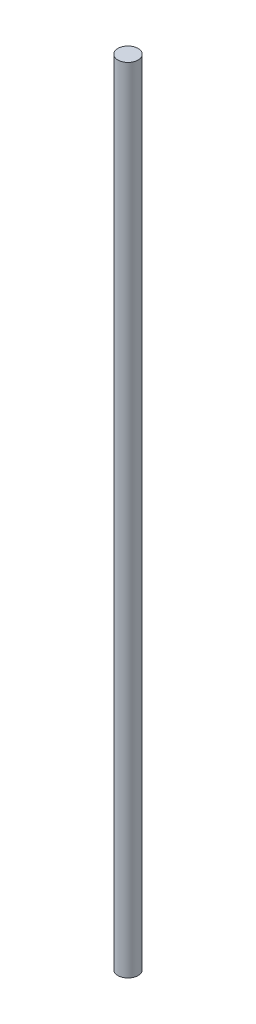
from build123d import *

# Parameters (mm, degrees)
SKETCH1_R           = 3.175
BOSS_EXTRUDE1_DEPTH = 250


with BuildPart() as part:
    # Sketch1 → Boss-Extrude1 (new body)
    with BuildSketch(Plane(origin=(0, 0, 0), x_dir=(1, 0, 0), z_dir=(0, 1, 0))):
        Circle(SKETCH1_R)
    extrude(amount=BOSS_EXTRUDE1_DEPTH)


solid = part.part
